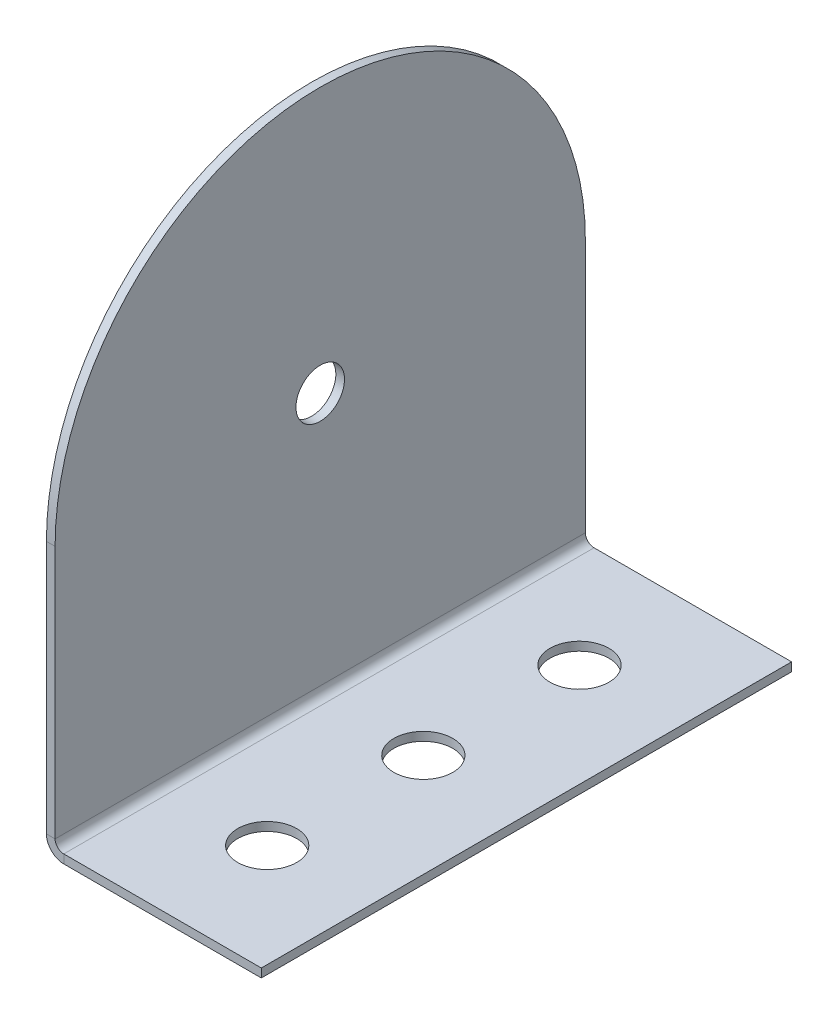
from build123d import *

# Parameters (mm, degrees)
SKETCH1_R                  = 2.5
SKETCH1_R_2                = 2.06
BASE_FLANGE3_DEPTH         = 0.7366
SKETCHED_START             = -43
SKETCHED_BEND1_OUTLINE_W   = 0.7366
SKETCHED_BEND1_OUTLINE_H   = 45
SKETCHED_BEND1_DEPTH       = 44.914756568
SKETCHED_START_2           = 2.495963432
SKETCHED_BEND1_2_OUTLINE_R = 2.06
SKETCHED_BEND1_2_DEPTH     = 0.004036568
SKETCHED_START_3           = 1.7634
SKETCHED_BEND1_3_OUTLINE_R = 2.06
SKETCHED_BEND1_3_DEPTH     = 1.4732
SKETCHED_START_4           = -23
SKETCHED_BEND1_4_DEPTH     = 46


with BuildPart() as part:
    # Base-Flange3: sheet metal written as solids
    # Sketch1 → Base-Flange3 (new body)
    with BuildSketch(Plane(origin=(0, 0, 0), x_dir=(1, 0, 0), z_dir=(0, 1, 0))):
        with BuildLine():
            Line((-20, 22.5), (20, 22.5))
            Line((20, 22.5), (20, -22.5))
            Line((20, -22.5), (-20, -22.5))
            ThreePointArc((-20, -22.5), (-42.5, 0), (-20, 22.5))
        make_face()
        with Locations(Location((11.25, -13.25, 0), (0, 0, 270))):
            Circle(SKETCH1_R, mode=Mode.SUBTRACT)
        with Locations(Location((11.25, 13.25, 0), (0, 0, 270))):
            Circle(SKETCH1_R, mode=Mode.SUBTRACT)
        with Locations(Location((11.25, 0, 0), (0, 0, 270))):
            Circle(SKETCH1_R, mode=Mode.SUBTRACT)
        with Locations(Location((-20, 0, 0), (0, 0, 270))):
            Circle(SKETCH1_R_2, mode=Mode.SUBTRACT)
    extrude(amount=-BASE_FLANGE3_DEPTH)

    # Sketched Bend1: read off the stored shape, not the designer's step
    # Sketched Bend1 outline → Sketched Bend1 (cut)
    with BuildSketch(Plane.YZ.offset(SKETCHED_START)):
        with Locations((-0.3683, 0)):
            Rectangle(SKETCHED_BEND1_OUTLINE_W, SKETCHED_BEND1_OUTLINE_H)
    extrude(amount=SKETCHED_BEND1_DEPTH, mode=Mode.SUBTRACT)

    # Sketched Bend1 2 outline → Sketched Bend1 2 (add)
    with BuildSketch(Plane.YZ.offset(SKETCHED_START_2)):
        with BuildLine():
            ThreePointArc((22.237627139, -22.5), (44.737627139, 0), (22.237627139, 22.5))
            Line((22.237627139, 22.5), (0, 22.5))
            Line((0, 22.5), (0, -22.5))
            Line((0, -22.5), (22.237627139, -22.5))
        make_face()
        with Locations((22.237627139, 0)):
            Circle(SKETCHED_BEND1_2_OUTLINE_R, mode=Mode.SUBTRACT)
    extrude(amount=SKETCHED_BEND1_2_DEPTH)

    # Sketched Bend1 3 outline → Sketched Bend1 3 (add)
    with BuildSketch(Plane.YZ.offset(SKETCHED_START_3)):
        with BuildLine():
            ThreePointArc((22.237627139, -22.5), (44.737627139, 0), (22.237627139, 22.5))
            Line((22.237627139, 22.5), (0, 22.5))
            Line((0, 22.5), (0, -22.5))
            Line((0, -22.5), (22.237627139, -22.5))
        make_face()
        with Locations((22.237627139, 0)):
            Circle(SKETCHED_BEND1_3_OUTLINE_R, mode=Mode.SUBTRACT)
    extrude(amount=SKETCHED_BEND1_3_DEPTH)

    # Sketched Bend1 4 outline → Sketched Bend1 4 (cut)
    with BuildSketch(Plane.XY.offset(SKETCHED_START_4)):
        with BuildLine():
            Line((2.5, 46), (2.5, 0.7366))
            ThreePointArc((2.5, 0.7366), (2.715745145, 0.215745145), (3.2366, 0))
            Line((3.2366, 0), (3.2366, 46))
            Line((3.2366, 46), (2.5, 46))
        make_face()
        with BuildLine():
            Line((1.7634, 0.7366), (1.763399995, 46))
            Line((1.763399995, 46), (0, 46))
            Line((0, 46), (0, 0))
            Line((0, 0), (1.914756568, 0))
            Line((1.914756568, 0), (1.914756568, -2))
            Line((1.914756568, -2), (5, -2))
            Line((5, -2), (5, -0.7366))
            Line((5, -0.7366), (3.2366, -0.7366))
            ThreePointArc((3.2366, -0.7366), (2.19489029, -0.30510971), (1.7634, 0.7366))
        make_face()
    extrude(amount=SKETCHED_BEND1_4_DEPTH, mode=Mode.SUBTRACT)


solid = part.part
